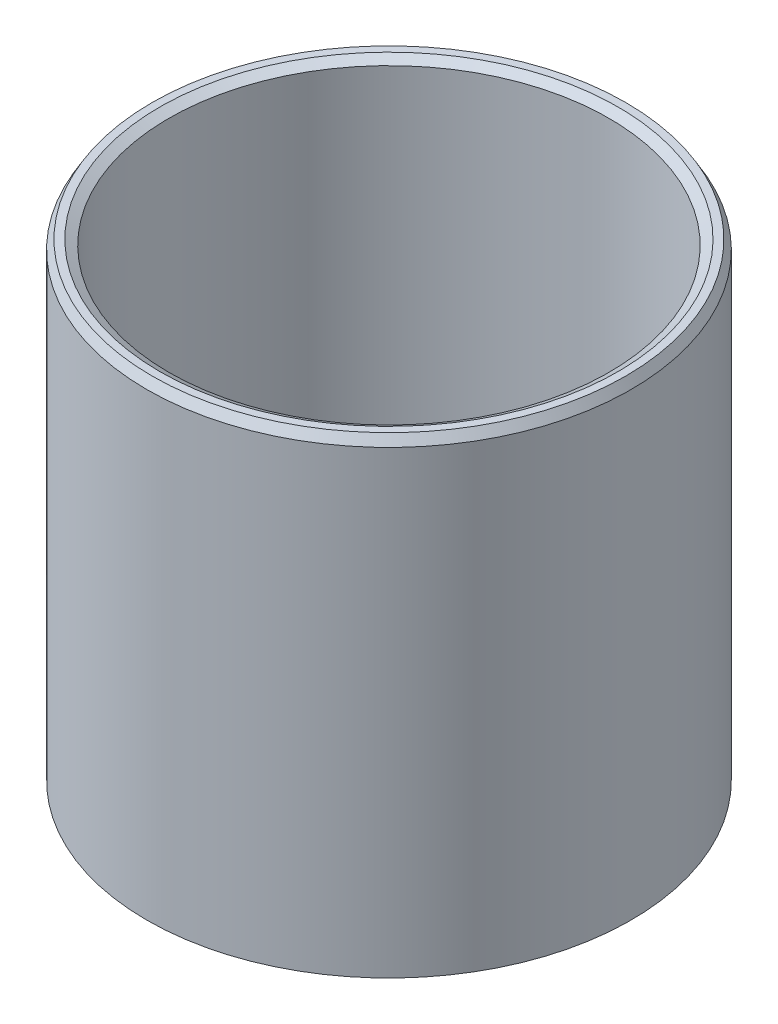
from build123d import *
from OCP.BRepFilletAPI import BRepFilletAPI_MakeChamfer

# Parameters (mm, degrees)
SKETCH1_R           = 55
BOSS_EXTRUDE1_DEPTH = 107.640320814
SKETCH2_R           = 49.995656528
CUT_EXTRUDE1_DEPTH  = 133.802253991
CHAMFER1_SIZE       = 2.063558022
CHAMFER1_SIZE2      = 1.19139578


with BuildPart() as part:
    # Sketch1 → Boss-Extrude1 (new body)
    with BuildSketch(Plane(origin=(0, 0, 0), x_dir=(1, 0, 0), z_dir=(0, 1, 0))):
        Circle(SKETCH1_R)
    extrude(amount=BOSS_EXTRUDE1_DEPTH)

    # Sketch2 → Cut-Extrude1 (cut, through all)
    with BuildSketch(Plane(origin=(0, 0, 0), x_dir=(1, 0, 0), z_dir=(0, 1, 0))):
        Circle(SKETCH2_R)
    extrude(amount=CUT_EXTRUDE1_DEPTH, mode=Mode.SUBTRACT)

    # Chamfer1: one chamfer whose edges measure the first distance from different faces: ONE call of the kernel's chamfer builder (chamfer() names one face for all edges)
    chamfer1_edges_1 = [part.edges().sort_by_distance(p)[0] for p in [
        (-49.995656528, 107.640320814, 0),
    ]]
    chamfer1_side_1 = [part.faces().sort_by_distance(p)[0] for p in [
        (-53.444365081, 107.640320814, 0),
    ]]
    chamfer1_edges_2 = [part.edges().sort_by_distance(p)[0] for p in [
        (-49.995656528, 0, 0),
    ]]
    chamfer1_side_2 = [part.faces().sort_by_distance(p)[0] for p in [
        (-49.995656528, 53.820160407, 0),
    ]]
    chamfer1_edges_3 = [part.edges().sort_by_distance(p)[0] for p in [
        (-55, 0, 0),
    ]]
    chamfer1_side_3 = [part.faces().sort_by_distance(p)[0] for p in [
        (-53.444365081, 0, 0),
    ]]
    chamfer1_edges_4 = [part.edges().sort_by_distance(p)[0] for p in [
        (-55, 107.640320814, 0),
    ]]
    chamfer1_side_4 = [part.faces().sort_by_distance(p)[0] for p in [
        (-55, 53.820160407, 0),
    ]]
    chamfer1 = BRepFilletAPI_MakeChamfer(part.part.solid().wrapped)
    for e in chamfer1_edges_1:
        chamfer1.Add(CHAMFER1_SIZE, CHAMFER1_SIZE2, e.wrapped, chamfer1_side_1[0].wrapped)  # the first distance lies on this face
    for e in chamfer1_edges_2:
        chamfer1.Add(CHAMFER1_SIZE, CHAMFER1_SIZE2, e.wrapped, chamfer1_side_2[0].wrapped)  # the first distance lies on this face
    for e in chamfer1_edges_3:
        chamfer1.Add(CHAMFER1_SIZE, CHAMFER1_SIZE2, e.wrapped, chamfer1_side_3[0].wrapped)  # the first distance lies on this face
    for e in chamfer1_edges_4:
        chamfer1.Add(CHAMFER1_SIZE, CHAMFER1_SIZE2, e.wrapped, chamfer1_side_4[0].wrapped)  # the first distance lies on this face
    add(Compound.cast(chamfer1.Shape()), mode=Mode.REPLACE)


solid = part.part
